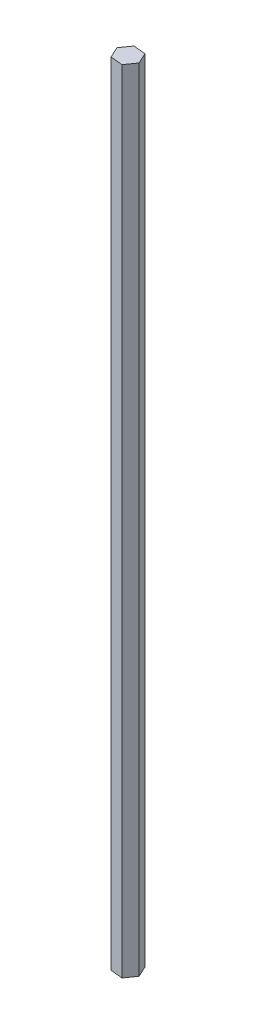
from build123d import *

# Parameters (mm, degrees)
BOSS_EXTRUDE1_DEPTH = 476.25


with BuildPart() as part:
    # Sketch1 → Boss-Extrude1 (new body)
    with BuildSketch(Plane(origin=(0, 0, 0), x_dir=(1, 0, 0), z_dir=(0, 1, 0))):
        Polygon((3.058481936, -6.664009422), (7.300442419, -0.683281657), (4.241960483, 5.980727765), (-3.058481936, 6.664009422), (-7.300442419, 0.683281657), (-4.241960483, -5.980727765), align=None)
    extrude(amount=BOSS_EXTRUDE1_DEPTH)


solid = part.part
